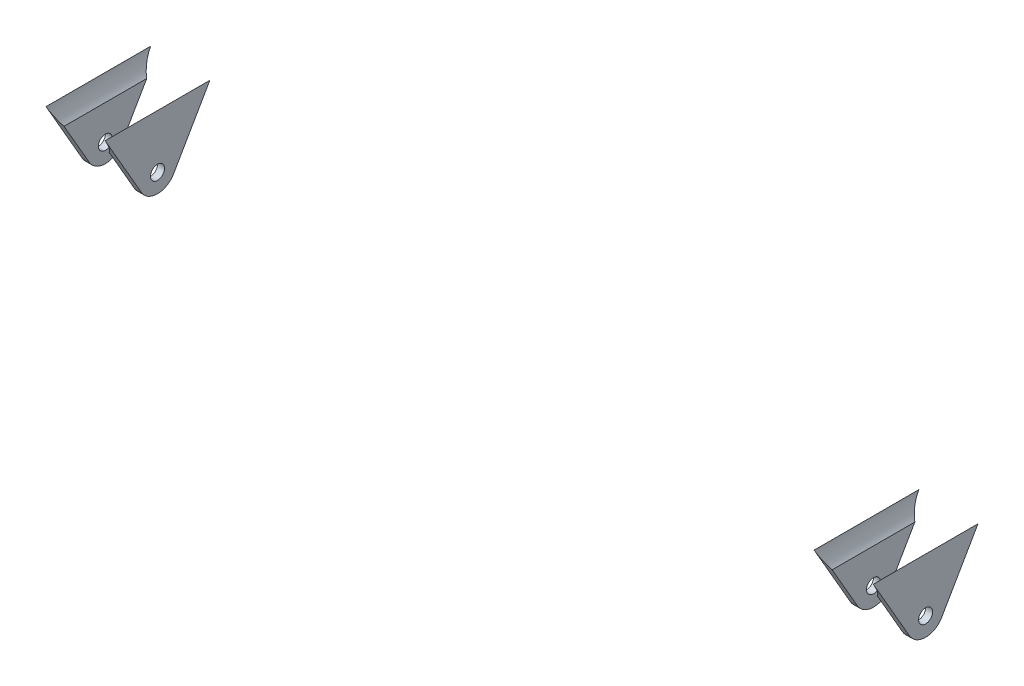
from build123d import *

# Parameters (mm, degrees)
F_3DSKETCH1_R       = 3
BOSS_EXTRUDE1_DEPTH = 3
INDENT1_START       = 199
INDENT1_DEPTH       = 47
INDENT1_START_2     = 200
INDENT1_2_DEPTH     = 45
INDENT1_START_3     = 174
INDENT1_3_DEPTH     = 3
INDENT2_START       = 199
INDENT2_DEPTH       = 47
INDENT2_START_2     = 200
INDENT2_2_DEPTH     = 45
INDENT2_START_3     = 153
INDENT2_3_DEPTH     = 3


with BuildPart() as part:
    # 3DSketch1 → Boss-Extrude1 (new body)
    with BuildSketch(Plane(origin=(152.3, 200, 245), x_dir=(0, 0, -1), z_dir=(-1, 0, 0))):
        with BuildLine():
            Line((0, 0), (45, 0))
            Line((45, 0), (29.430054259, 26.99679221))
            ThreePointArc((29.430054259, 26.99679221), (22.5, 31), (15.569945741, 26.99679221))
            Line((15.569945741, 26.99679221), (0, 0))
        make_face()
        with Locations((22.5, 23)):
            Circle(F_3DSKETCH1_R, mode=Mode.SUBTRACT)
    extrude(amount=-BOSS_EXTRUDE1_DEPTH)


with BuildPart() as body_2:
    # Mirror1: mirrored copy
    add(part.part.mirror(Plane(origin=(165, 0, 0), x_dir=(0, 0, 1), z_dir=(1, 0, 0))))

    # Indent1: read off the stored shape, not the designer's step
    # Indent1 outline → Indent1 (cut)
    with BuildSketch(Plane.XY.offset(INDENT1_START)):
        with BuildLine():
            Line((174.7, 200), (174.7, 191.802439387))
            ThreePointArc((174.7, 191.802439387), (176.926441213, 195.635369431), (177.7, 200))
            Line((177.7, 200), (174.7, 200))
        make_face()
    extrude(amount=INDENT1_DEPTH, mode=Mode.SUBTRACT)


with BuildPart() as body_3:
    # Indent1 2 outline → Indent1 2 (new body)
    with BuildSketch(Plane.XY.offset(INDENT1_START_2)):
        with BuildLine():
            Line((176.4, 200), (174.7, 200))
            Line((174.7, 200), (174.7, 194.010843131))
            ThreePointArc((174.7, 194.010843131), (175.966767983, 196.887123517), (176.4, 200))
        make_face()
    extrude(amount=INDENT1_2_DEPTH)

    # Indent1 3 outline → Indent1 3 (cut)
    with BuildSketch(Plane.YZ.offset(INDENT1_START_3)):
        Polygon((200, 200), (194.010843131, 203.454145469), (193, 204.037132239), (193, 200), align=None)
        Polygon((193, 245), (193, 240.962867761), (194.010843131, 241.545854531), (200, 245), align=None)
    extrude(amount=INDENT1_3_DEPTH, mode=Mode.SUBTRACT)


with BuildPart() as part_1:
    add(part.part)

    # Indent2: read off the stored shape, not the designer's step
    # Indent2 outline → Indent2 (cut)
    with BuildSketch(Plane.XY.offset(INDENT2_START)):
        with BuildLine():
            Line((155.3, 200), (152.3, 200))
            ThreePointArc((152.3, 200), (153.073558787, 195.635369431), (155.3, 191.802439387))
            Line((155.3, 191.802439387), (155.3, 200))
        make_face()
    extrude(amount=INDENT2_DEPTH, mode=Mode.SUBTRACT)


with BuildPart() as body_4:
    # Indent2 2 outline → Indent2 2 (new body)
    with BuildSketch(Plane.XY.offset(INDENT2_START_2)):
        with BuildLine():
            Line((155.3, 200), (153.6, 200))
            ThreePointArc((153.6, 200), (154.033232017, 196.887123517), (155.3, 194.010843131))
            Line((155.3, 194.010843131), (155.3, 200))
        make_face()
    extrude(amount=INDENT2_2_DEPTH)

    # Indent2 3 outline → Indent2 3 (cut)
    with BuildSketch(Plane.YZ.offset(INDENT2_START_3)):
        Polygon((194.010843131, 241.545854531), (200, 245), (193, 245), (193, 240.962867761), align=None)
        Polygon((194.010843131, 203.454145469), (193, 204.037132239), (193, 200), (200, 200), align=None)
    extrude(amount=INDENT2_3_DEPTH, mode=Mode.SUBTRACT)


with BuildPart() as body_3_2:
    # Mirror2: mirrored copy
    add(body_2.part.mirror(Plane(origin=(0, 0, 0), x_dir=(0, 0, 1), z_dir=(1, 0, 0))))


with BuildPart() as body_4_2:
    # Mirror2 2: mirrored copy
    add(part_1.part.mirror(Plane(origin=(0, 0, 0), x_dir=(0, 0, 1), z_dir=(1, 0, 0))))


solid = Compound([body_2.part, part_1.part, body_3_2.part, body_4_2.part])
